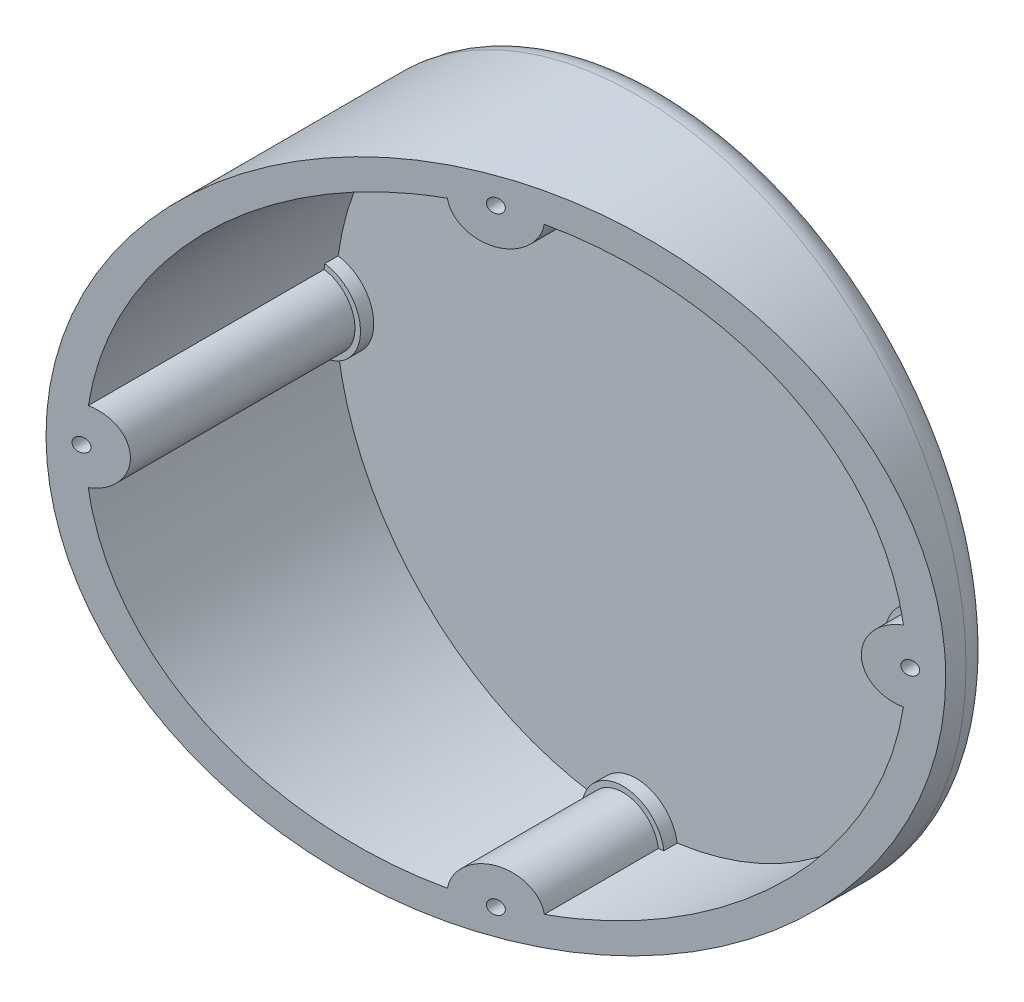
from build123d import *

# Parameters (mm, degrees)
SKETCH_1_R                = 57
EXTRUDE_1_DEPTH           = 50
CUT_EXTRUDE_1_DEPTH       = 95.857788294
CUT_EXTRUDE_1_DEPTH_BACK  = 95.857788294
FILLET_1_R                = 5
HOLE_WIZARD_1_D           = 2.4
HOLE_WIZARD_1_CBORE_D     = 4.3
HOLE_WIZARD_1_CBORE_DEPTH = 2.3
PATTERN_CIRCULAR_1_COUNT  = 4
SHELL_START               = 5
SHELL_1_DEPTH             = 43.047767655
SHELL_START_2             = 7.3
SHELL_1_2_DEPTH           = 40.747767655


# Read off the part's stored shape, not the designer's step: 抽壳1
with BuildPart() as part:
    # 草图1 → 凸台-拉伸1 (new body)
    with BuildSketch(Plane.XY):
        Circle(SKETCH_1_R)
    extrude(amount=EXTRUDE_1_DEPTH)

    # 草图2 → 切除-拉伸1 (cut, two sides: drawn at the far end of the back side and taken through both)
    with BuildSketch(Plane(origin=(0, 0, 0), x_dir=(1, 0, 0), z_dir=(0, 1, 0)).offset(-CUT_EXTRUDE_1_DEPTH_BACK)):
        Polygon((-57, -50), (57, -50), (57, -8.507393294), align=None)
    extrude(amount=CUT_EXTRUDE_1_DEPTH + CUT_EXTRUDE_1_DEPTH_BACK, mode=Mode.SUBTRACT)

    # 圆角1
    fillet_1_edges = [part.edges().sort_by_distance(p)[0] for p in [
        (-57, 0, 0),
    ]]
    fillet(fillet_1_edges, radius=FILLET_1_R)

    # 打孔尺寸(%根据)内六角圆柱头螺钉的类型1 (through all)
    with Locations(Plane(origin=(0, 0, 0), x_dir=(-1, 0, 0), z_dir=(0, 0, -1))):
        with Locations((0, 52.5)):
            hole_wizard_1 = CounterBoreHole(HOLE_WIZARD_1_D / 2, HOLE_WIZARD_1_CBORE_D / 2, HOLE_WIZARD_1_CBORE_DEPTH)

    # 阵列(圆周)1: 打孔尺寸(%根据)内六角圆柱头螺钉的类型1 ×4 about axis
    pattern_circular_1_axis = Axis((0, 0, 0), (0, 0, 1))
    for i in range(1, PATTERN_CIRCULAR_1_COUNT):
        add(hole_wizard_1.rotate(pattern_circular_1_axis, i * 360 / PATTERN_CIRCULAR_1_COUNT), mode=Mode.SUBTRACT)

    # 抽壳1 outline → 抽壳1 (cut)
    with BuildSketch(Plane.XY.offset(SHELL_START)):
        with BuildLine():
            ThreePointArc((7.081896621, -51.5155), (36.769552622, -36.769552622), (51.5155, -7.081896621))
            ThreePointArc((51.5155, -7.081896621), (45.35, 0), (51.5155, 7.081896621))
            ThreePointArc((51.5155, 7.081896621), (36.769552622, 36.769552622), (7.081896621, 51.5155))
            ThreePointArc((7.081896621, 51.5155), (0, 45.35), (-7.081896621, 51.5155))
            ThreePointArc((-7.081896621, 51.5155), (-36.769552622, 36.769552622), (-51.5155, 7.081896621))
            ThreePointArc((-51.5155, 7.081896621), (-45.35, 0), (-51.5155, -7.081896621))
            ThreePointArc((-51.5155, -7.081896621), (-36.769552622, -36.769552622), (-7.081896621, -51.5155))
            ThreePointArc((-7.081896621, -51.5155), (0, -45.35), (7.081896621, -51.5155))
        make_face()
    extrude(amount=SHELL_1_DEPTH, mode=Mode.SUBTRACT)

    # Shell 1 2 outline → Shell 1 2 (cut)
    with BuildSketch(Plane.XY.offset(SHELL_START_2)):
        with BuildLine():
            ThreePointArc((51.5155, 7.081896621), (45.35, 0), (51.5155, -7.081896621))
            ThreePointArc((51.5155, -7.081896621), (51.57804505, -6.610996049), (51.636285714, -6.139543764))
            ThreePointArc((51.636285714, -6.139543764), (46.3, 0), (51.636285714, 6.139543764))
            ThreePointArc((51.636285714, 6.139543764), (51.57804505, 6.610996049), (51.5155, 7.081896621))
        make_face()
        with BuildLine():
            ThreePointArc((6.139543764, -51.636285714), (6.610996049, -51.57804505), (7.081896621, -51.5155))
            ThreePointArc((7.081896621, -51.5155), (0, -45.35), (-7.081896621, -51.5155))
            ThreePointArc((-7.081896621, -51.5155), (-6.610996049, -51.57804505), (-6.139543764, -51.636285714))
            ThreePointArc((-6.139543764, -51.636285714), (0, -46.3), (6.139543764, -51.636285714))
        make_face()
        with BuildLine():
            ThreePointArc((-7.081896621, 51.5155), (0, 45.35), (7.081896621, 51.5155))
            ThreePointArc((7.081896621, 51.5155), (6.610996049, 51.57804505), (6.139543764, 51.636285714))
            ThreePointArc((6.139543764, 51.636285714), (0, 46.3), (-6.139543764, 51.636285714))
            ThreePointArc((-6.139543764, 51.636285714), (-6.610996049, 51.57804505), (-7.081896621, 51.5155))
        make_face()
        with BuildLine():
            ThreePointArc((-51.636285714, -6.139543764), (-51.57804505, -6.610996049), (-51.5155, -7.081896621))
            ThreePointArc((-51.5155, -7.081896621), (-45.35, 0), (-51.5155, 7.081896621))
            ThreePointArc((-51.5155, 7.081896621), (-51.57804505, 6.610996049), (-51.636285714, 6.139543764))
            ThreePointArc((-51.636285714, 6.139543764), (-46.3, 0), (-51.636285714, -6.139543764))
        make_face()
    extrude(amount=SHELL_1_2_DEPTH, mode=Mode.SUBTRACT)


solid = part.part
